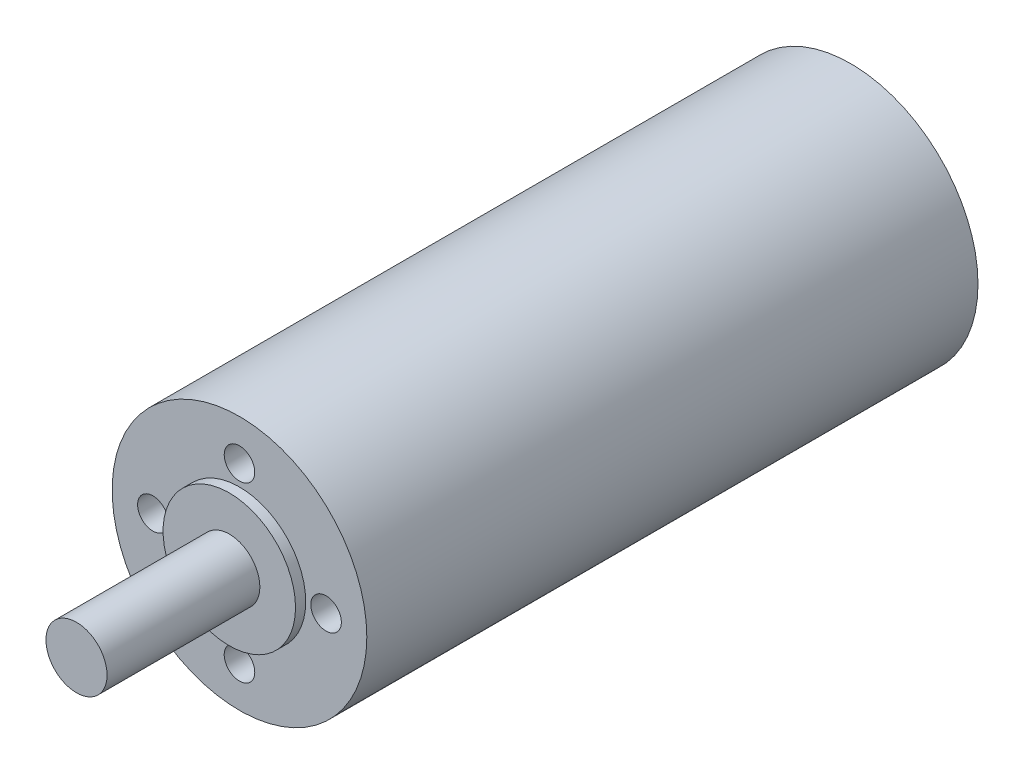
from build123d import *

# Parameters (mm, degrees)
ESBO_O1_R                = 12.5
RESSALTO_EXTRUS_O1_DEPTH = 60
ESBO_O2_R                = 6.5
RESSALTO_EXTRUS_O2_DEPTH = 1
ESBO_O3_R                = 3
RESSALTO_EXTRUS_O3_DEPTH = 15
ESBO_O4_R                = 1.5
CORTE_EXTRUS_O1_DEPTH    = 4
PADR_OCIRCULAR1_COUNT    = 4


with BuildPart() as part:
    # Esboço1 → Ressalto-extrusão1 (new body)
    with BuildSketch(Plane.XY):
        Circle(ESBO_O1_R)
    extrude(amount=RESSALTO_EXTRUS_O1_DEPTH)

    # Esboço2 → Ressalto-extrusão2 (add)
    with BuildSketch(Plane.XY.offset(60)):
        Circle(ESBO_O2_R)
    extrude(amount=RESSALTO_EXTRUS_O2_DEPTH)

    # Esboço3 → Ressalto-extrusão3 (add)
    with BuildSketch(Plane.XY.offset(61)):
        Circle(ESBO_O3_R)
    extrude(amount=RESSALTO_EXTRUS_O3_DEPTH)

    # Esboço4 → Corte-extrusão1 (cut)
    with BuildSketch(Plane.XY.offset(60)):
        with Locations((0, -8.5)):
            Circle(ESBO_O4_R)
    corte_extrus_o1 = extrude(amount=-CORTE_EXTRUS_O1_DEPTH, mode=Mode.SUBTRACT)

    # PadrãoCircular1: Corte-extrusão1 ×4 about axis
    padr_ocircular1_axis = Axis((0, 0, 76), (0, 0, -1))
    for i in range(1, PADR_OCIRCULAR1_COUNT):
        add(corte_extrus_o1.rotate(padr_ocircular1_axis, i * 360 / PADR_OCIRCULAR1_COUNT), mode=Mode.SUBTRACT)


solid = part.part
